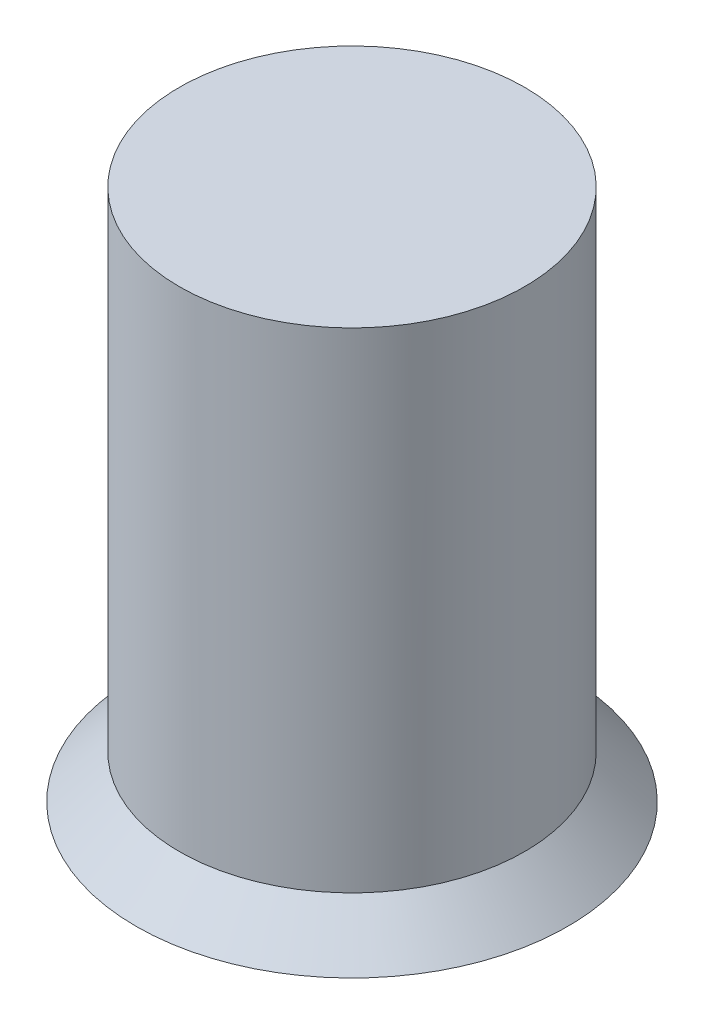
from build123d import *

# Parameters (mm, degrees)
ESQUISSE1_R        = 15
BOSS_EXTRU_1_DEPTH = 3
CHANFREIN1_SIZE    = 3
ESQUISSE2_R        = 12
BOSS_EXTRU_2_DEPTH = 34


with BuildPart() as part:
    # Esquisse1 → Boss.-Extru.1 (new body)
    with BuildSketch(Plane(origin=(0, 0, 0), x_dir=(1, 0, 0), z_dir=(0, 1, 0))):
        with Locations(Location((0, 0, 0), (0, 0, 270))):
            Circle(ESQUISSE1_R)
    extrude(amount=BOSS_EXTRU_1_DEPTH)

    # Chanfrein1
    chanfrein1_edges = [part.edges().sort_by_distance(p)[0] for p in [
        (0, 3, -15),
    ]]
    chamfer(chanfrein1_edges, length=CHANFREIN1_SIZE - 0.0001)  # a hair under: the kernel refuses the full size

    # Esquisse2 → Boss.-Extru.2 (add)
    with BuildSketch(Plane(origin=(0, 3, 0), x_dir=(1, 0, 0), z_dir=(0, 1, 0))):
        with Locations(Location((0, 0, 0), (0, 0, 90))):
            Circle(ESQUISSE2_R)
    extrude(amount=BOSS_EXTRU_2_DEPTH)


solid = part.part
